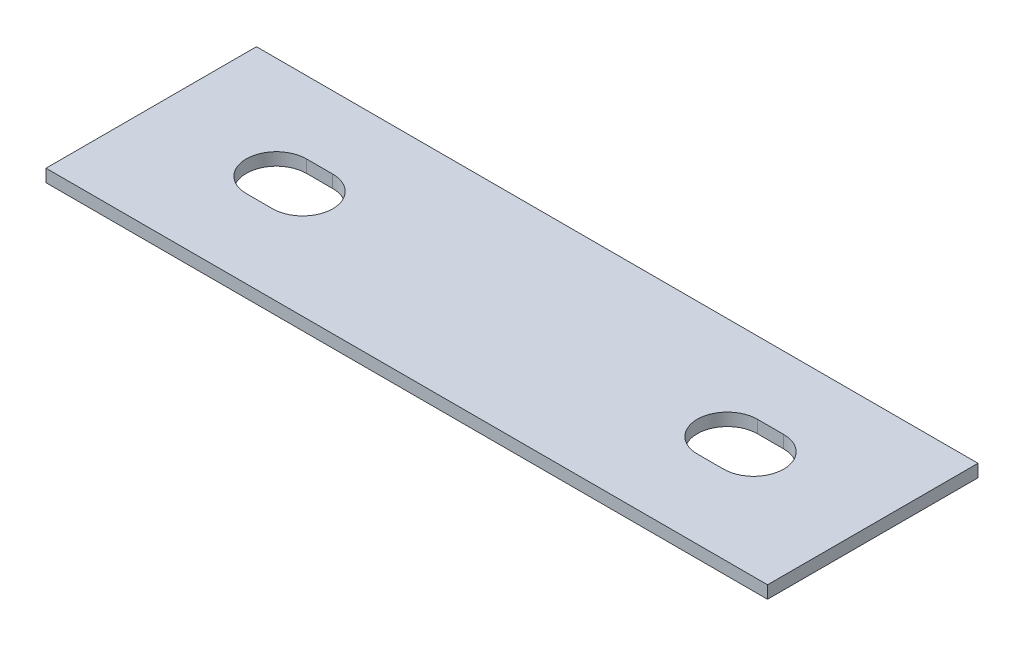
from build123d import *

# Parameters (mm, degrees)
SKETCH1_W          = 152.4
SKETCH1_H          = 44.45
BASE_FLANGE1_DEPTH = 2.65684
CUT_EXTRUDE3_DEPTH = 159.772230881


# Sheet-metal steps are written as plain solids
with BuildPart() as part:
    # Sketch1 → Base-Flange1 (new body)
    with BuildSketch(Plane(origin=(0, 0, 0), x_dir=(1, 0, 0), z_dir=(0, 1, 0))):
        with Locations((76.2, 22.225)):
            Rectangle(SKETCH1_W, SKETCH1_H)
    extrude(amount=-BASE_FLANGE1_DEPTH)

    # Sketch10 → Cut-Extrude3 (cut, through all)
    with BuildSketch(Plane.XZ.offset(2.65684)):
        with BuildLine():
            Line((25.796875, -29.21), (31.353125, -29.21))
            ThreePointArc((31.353125, -29.21), (37.703125, -22.86), (31.353125, -16.51))
            Line((31.353125, -16.51), (25.796875, -16.51))
            ThreePointArc((25.796875, -16.51), (19.446875, -22.86), (25.796875, -29.21))
        make_face()
        with BuildLine():
            Line((121.046875, -29.21), (126.603125, -29.21))
            ThreePointArc((126.603125, -29.21), (132.953125, -22.86), (126.603125, -16.51))
            Line((126.603125, -16.51), (121.046875, -16.51))
            ThreePointArc((121.046875, -16.51), (114.696875, -22.86), (121.046875, -29.21))
        make_face()
    extrude(amount=-CUT_EXTRUDE3_DEPTH, mode=Mode.SUBTRACT)


solid = part.part
